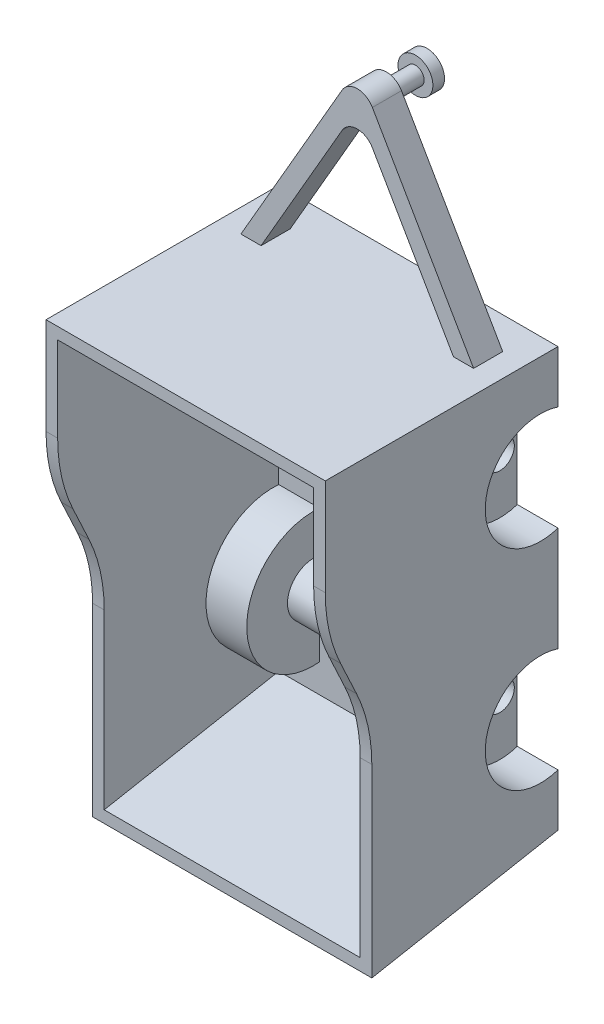
from build123d import *

# Parameters (mm, degrees)
BOSS_EXTRUDE1_DEPTH                        = 609.6
FILLET1_R                                  = 355.6
SKETCH2_R                                  = 31.75
CUT_EXTRUDE1_DEPTH                         = 609.6
SKETCH4_R                                  = 120.65
CUT_EXTRUDE2_DEPTH                         = 88.9
MIRROR1_AT_THE_SECOND_PLANE_COPY_1_SKETC_R = 120.65
MIRROR1_AT_THE_SECOND_PLANE_COPY_1_DEPTH   = 88.9
SHELL1_START                               = 25.4
SHELL1_DEPTH                               = 558.8
SHELL1_START_2                             = 114.3
SHELL1_2_DEPTH                             = 381
BOSS_EXTRUDE6_START                        = -69.85
BOSS_EXTRUDE6_DEPTH                        = 63.5
SKETCH8_R                                  = 19.05
BOSS_EXTRUDE7_DEPTH                        = 63.5
BOSS_EXTRUDE8_START                        = 25.4
SKETCH9_R                                  = 38.1
BOSS_EXTRUDE8_DEPTH                        = 25.4


# Read off the part's stored shape, not the designer's step: Shell1
with BuildPart() as part:
    # Sketch1 → Boss-Extrude1 (new body)
    with BuildSketch(Plane(origin=(0, 0, 0), x_dir=(0, 0, -1), z_dir=(1, 0, 0))):
        Polygon((0, 0), (-406.4, -76.2), (-406.4, 406.4), (-508, 624.281903124), (-508, 914.4), (0, 914.4), align=None)
    extrude(amount=BOSS_EXTRUDE1_DEPTH)

    # Fillet1
    fillet1_edges = [part.edges().sort_by_distance(p)[0] for p in [
        (304.8, 406.4, 406.4),
        (304.8, 624.281903124, 508),
    ]]
    fillet(fillet1_edges, radius=FILLET1_R)

    # Sketch2 → Cut-Extrude1 (cut)
    with BuildSketch(Plane.ZY):
        with Locations((38.1, 228.6)):
            Circle(SKETCH2_R)
        with Locations((38.1, 685.8)):
            Circle(SKETCH2_R)
    extrude(amount=-CUT_EXTRUDE1_DEPTH, mode=Mode.SUBTRACT)

    # Sketch4 → Cut-Extrude2 (cut)
    with BuildSketch(Plane(origin=(609.6, 0, 0), x_dir=(0, 0, -1), z_dir=(1, 0, 0))):
        with Locations((-38.1, 685.8)):
            Circle(SKETCH4_R)
    cut_extrude2 = extrude(amount=-CUT_EXTRUDE2_DEPTH, mode=Mode.SUBTRACT)

    # Mirror1: Cut-Extrude2 across plane
    add(cut_extrude2.mirror(Plane(origin=(304.8, 0, 0), x_dir=(0, 0, 1), z_dir=(1, 0, 0))), mode=Mode.SUBTRACT)

    # Mirror1 at the second plane: Cut-Extrude2 across plane
    add(cut_extrude2.mirror(Plane.ZX.offset(457.2)), mode=Mode.SUBTRACT)

    # Mirror1 at the second plane copy 1 sketc → Mirror1 at the second plane copy 1 (cut)
    with BuildSketch(Plane(origin=(0, 914.4, 0), x_dir=(0, 0, -1), z_dir=(-1, 0, 0))):
        with Locations((-38.1, 685.8)):
            Circle(MIRROR1_AT_THE_SECOND_PLANE_COPY_1_SKETC_R)
    extrude(amount=-MIRROR1_AT_THE_SECOND_PLANE_COPY_1_DEPTH, mode=Mode.SUBTRACT)

    # Shell1 outline → Shell1 (cut)
    with BuildSketch(Plane.YZ.offset(SHELL1_START)):
        with BuildLine():
            Line((374.096778315, 25.4), (540.303221685, 25.4))
            ThreePointArc((540.303221685, 25.4), (685.8, 184.15), (831.296778315, 25.4))
            Line((831.296778315, 25.4), (889, 25.4))
            Line((889, 25.4), (889, 508))
            Line((889, 508), (703.11652516, 508))
            ThreePointArc((703.11652516, 508), (626.150598444, 499.570860132), (552.833471285, 474.68304907))
            Line((552.833471285, 474.68304907), (477.848431839, 439.71695093))
            ThreePointArc((477.848431839, 439.71695093), (404.53130468, 414.829139868), (327.565377964, 406.4))
            Line((327.565377964, 406.4), (-50.357372304, 406.4))
            Line((-50.357372304, 406.4), (21.080127696, 25.4))
            Line((21.080127696, 25.4), (83.103221685, 25.4))
            ThreePointArc((83.103221685, 25.4), (228.6, 184.15), (374.096778315, 25.4))
        make_face()
    extrude(amount=SHELL1_DEPTH, mode=Mode.SUBTRACT)

    # Shell1 2 outline → Shell1 2 (cut)
    with BuildSketch(Plane.YZ.offset(SHELL1_START_2)):
        with BuildLine():
            Line((540.303221685, 25.4), (630.07897614, 25.4))
            ThreePointArc((630.07897614, 25.4), (685.8, 95.25), (741.52102386, 25.4))
            Line((741.52102386, 25.4), (831.296778315, 25.4))
            ThreePointArc((831.296778315, 25.4), (685.8, 184.15), (540.303221685, 25.4))
        make_face()
        with BuildLine():
            Line((284.32102386, 25.4), (374.096778315, 25.4))
            ThreePointArc((374.096778315, 25.4), (228.6, 184.15), (83.103221685, 25.4))
            Line((83.103221685, 25.4), (172.87897614, 25.4))
            ThreePointArc((172.87897614, 25.4), (228.6, 95.25), (284.32102386, 25.4))
        make_face()
    extrude(amount=SHELL1_2_DEPTH, mode=Mode.SUBTRACT)

    # Sketch6 → Boss-Extrude6 (add)
    with BuildSketch(Plane(origin=(0, 0, 0), x_dir=(-1, 0, 0), z_dir=(0, 0, -1)).offset(BOSS_EXTRUDE6_START)):
        with BuildLine():
            Line((-558.8, 914.4), (-514.805909488, 914.4))
            Line((-514.805909488, 914.4), (-337.795567884, 1220.990905122))
            ThreePointArc((-337.795567884, 1220.990905122), (-304.8, 1240.040905122), (-271.804432116, 1220.990905122))
            Line((-271.804432116, 1220.990905122), (-94.794090512, 914.4))
            Line((-94.794090512, 914.4), (-50.8, 914.4))
            Line((-50.8, 914.4), (-271.804432116, 1297.190905122))
            ThreePointArc((-271.804432116, 1297.190905122), (-304.8, 1316.240905122), (-337.795567884, 1297.190905122))
            Line((-337.795567884, 1297.190905122), (-558.8, 914.4))
        make_face()
    extrude(amount=-BOSS_EXTRUDE6_DEPTH)

    # Sketch8 → Boss-Extrude7 (add)
    with BuildSketch(Plane(origin=(0, 0, 69.85), x_dir=(-1, 0, 0), z_dir=(0, 0, -1))):
        with Locations(Location((-304.8, 1278.140905122, 0), (0, 0, 90))):
            Circle(SKETCH8_R)
    extrude(amount=BOSS_EXTRUDE7_DEPTH)

    # Sketch9 → Boss-Extrude8 (add)
    with BuildSketch(Plane(origin=(0, 0, 6.35), x_dir=(-1, 0, 0), z_dir=(0, 0, -1)).offset(BOSS_EXTRUDE8_START)):
        with Locations(Location((-304.8, 1278.140905122, 0), (0, 0, 90))):
            Circle(SKETCH9_R)
    extrude(amount=-BOSS_EXTRUDE8_DEPTH)


solid = part.part
